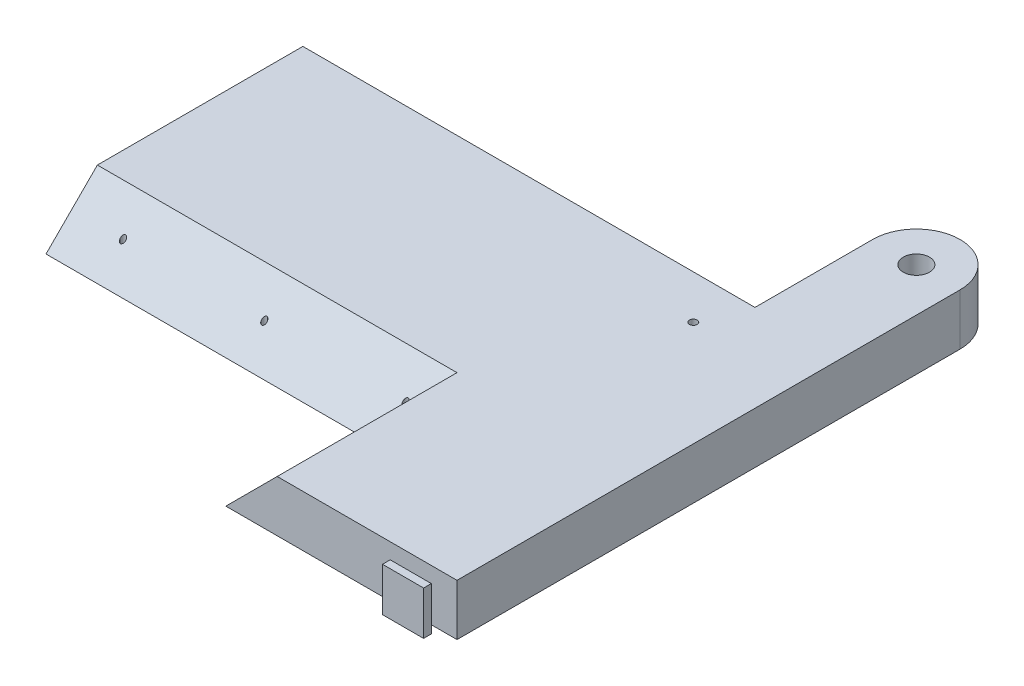
from build123d import *

# Parameters (mm, degrees)
CORNERBOSS_EXTRUDE1_DEPTH               = 20
SHELL1_T                                = -3
PUTBACKPARTOFSHELLBOSS_EXTRUDE1_DEPTH   = 17
TABHOLECUTSSKETCH1_R                    = 1
TABHOLECUTS_EXTRUDE3_DEPTH              = 267.480732183
PADSKETCH2_R                            = 12
PADSKETCH2_R_2                          = 5
PADBOSS_EXTRUDE2_DEPTH                  = 10
STEPPERRODHOLESKETCH3_R                 = 5.1
STEPPERRODHOLESKETCH3_R_2               = 1.5
STEPPERRODHOLECUT_EXTRUDE1_DEPTH        = 267.046951918
THREADEDNUTMOUNTHOLESSKETCH4_R          = 1
THREADEDNUTMOUNTHOLESCUT_EXTRUDE2_DEPTH = 10
TLPEGHOLESKETCH1_W                      = 10
TLPEGHOLESKETCH1_H                      = 14
TLPEGHOLECUT_EXTRUDE1_DEPTH             = 3
BOTTOMPEGSKETCH2_W                      = 9.8
BOTTOMPEGSKETCH2_H                      = 13.9
BOTTOMPEGBOSS_EXTRUDE1_DEPTH            = 3.1
BOTTOMPEGCAPSKETCH3_W                   = 16
BOTTOMPEGCAPSKETCH3_H                   = 17
BOTTOMPEGCAPBOSS_EXTRUDE2_DEPTH         = 3


with BuildPart() as part:
    # CornerSketch1 → CornerBoss-Extrude1 (new body)
    with BuildSketch(Plane(origin=(0, 0, 0), x_dir=(1, 0, 0), z_dir=(0, 1, 0))):
        with BuildLine():
            Line((210, -50), (120, -50))
            Line((120, -50), (120, 0))
            Line((120, 0), (0, 0))
            Line((0, 0), (0, 100))
            Line((0, 100), (176, 100))
            Line((176, 100), (176, 145.825))
            ThreePointArc((176, 145.825), (193, 162.825), (210, 145.825))
            Line((210, 145.825), (210, -50))
        make_face()
    extrude(amount=CORNERBOSS_EXTRUDE1_DEPTH)

    # Shell1
    shell1_openings = [part.faces().sort_by_distance(p)[0] for p in [
        (121.249517572, 0, -43.561989295),
    ]]
    offset(amount=SHELL1_T, openings=shell1_openings, kind=Kind.INTERSECTION)

    # PutBackPartOfShellSketch1 → PutBackPartOfShellBoss-Extrude1 (add)
    with BuildSketch(Plane.XZ.offset(-17)):
        Polygon((3, -3), (123, -3), (123, 47), (143, 47), (143, -23), (3, -23), align=None)
    extrude(amount=PUTBACKPARTOFSHELLBOSS_EXTRUDE1_DEPTH)

    # TabHoleCutsSketch1 → TabHoleCuts-Extrude3 (cut, through all)
    with BuildSketch(Plane.XZ):
        with Locations(Location((130, 30, 0), (0, 0, 270))):
            Circle(TABHOLECUTSSKETCH1_R)
        with Locations(Location((130, -10, 0), (0, 0, 270))):
            Circle(TABHOLECUTSSKETCH1_R)
        with Locations(Location((75, -10, 0), (0, 0, 270))):
            Circle(TABHOLECUTSSKETCH1_R)
        with Locations(Location((20, -10, 0), (0, 0, 270))):
            Circle(TABHOLECUTSSKETCH1_R)
    extrude(amount=-TABHOLECUTS_EXTRUDE3_DEPTH, mode=Mode.SUBTRACT)

    # PadSketch2 → PadBoss-Extrude2 (add)
    with BuildSketch(Plane.XZ.offset(-17)):
        with Locations(Location((193, -145.825, 0), (0, 0, 90))):
            Circle(PADSKETCH2_R)
        with Locations(Location((169, -83, 0), (0, 0, 90))):
            Circle(PADSKETCH2_R_2)
    extrude(amount=PADBOSS_EXTRUDE2_DEPTH)

    # StepperRodHoleSketch3 → StepperRodHoleCut-Extrude1 (cut, through all)
    with BuildSketch(Plane.XZ.offset(-7)):
        with Locations(Location((193, -145.825, 0), (0, 0, 270))):
            Circle(STEPPERRODHOLESKETCH3_R)
        with Locations(Location((169, -83, 0), (0, 0, 270))):
            Circle(STEPPERRODHOLESKETCH3_R_2)
    extrude(amount=-STEPPERRODHOLECUT_EXTRUDE1_DEPTH, mode=Mode.SUBTRACT)

    # ThreadedNutMountHolesSketch4 → ThreadedNutMountHolesCut-Extrude2 (cut)
    with BuildSketch(Plane(origin=(0, 7, 0), x_dir=(-1, 0, 0), z_dir=(0, -1, 0))):
        with Locations(Location((-193, 153.825, 0), (0, 0, 90))):
            Circle(THREADEDNUTMOUNTHOLESSKETCH4_R)
        with Locations(Location((-185, 145.825, 0), (0, 0, 90))):
            Circle(THREADEDNUTMOUNTHOLESSKETCH4_R)
        with Locations(Location((-201, 145.825, 0), (0, 0, 90))):
            Circle(THREADEDNUTMOUNTHOLESSKETCH4_R)
        with Locations(Location((-193, 137.825, 0), (0, 0, 90))):
            Circle(THREADEDNUTMOUNTHOLESSKETCH4_R)
    extrude(amount=-THREADEDNUTMOUNTHOLESCUT_EXTRUDE2_DEPTH, mode=Mode.SUBTRACT)

    # TLPegHoleSketch1 → TLPegHoleCut-Extrude1 (cut)
    with BuildSketch(Plane.ZY):
        with Locations((-85, 7)):
            Rectangle(TLPEGHOLESKETCH1_W, TLPEGHOLESKETCH1_H)
    extrude(amount=-TLPEGHOLECUT_EXTRUDE1_DEPTH, mode=Mode.SUBTRACT)

    # BottomPegSketch2 → BottomPegBoss-Extrude1 (add)
    with BuildSketch(Plane.XY.offset(50)):
        with Locations((195, 6.95)):
            Rectangle(BOTTOMPEGSKETCH2_W, BOTTOMPEGSKETCH2_H)
    extrude(amount=BOTTOMPEGBOSS_EXTRUDE1_DEPTH)

    # BottomPegCapSketch3 → BottomPegCapBoss-Extrude2 (add)
    with BuildSketch(Plane.XY.offset(53.1)):
        with Locations((195.1, 8.5)):
            Rectangle(BOTTOMPEGCAPSKETCH3_W, BOTTOMPEGCAPSKETCH3_H)
    extrude(amount=BOTTOMPEGCAPBOSS_EXTRUDE2_DEPTH)

    # OverlapChamfer1
    # the kernel refuses this chamfer: 20 mm, written as the material it takes off along each edge
    with BuildSketch(Plane(origin=(120, 20, 50), x_dir=(-0.027495876610586317, -0.9996219169112968, 0), z_dir=(0, 0, -1))) as overlapchamfer1_piece_1:
        with BuildLine():
            Line((20.573463904, 0), (-1.130943098, -20.54235587))
            Line((-1.130943098, -20.54235587), (-1.530791864, -20.53135752))
            ThreePointArc((-1.530791864, -20.53135752), (-0.682584541, -10.267956593), (-0.399848767, 0.010998351))
            Line((-0.399848767, 0.010998351), (0.010998351, 0.399848767))
            ThreePointArc((0.010998351, 0.399848767), (10.289953294, 0.117112992), (20.584462254, 0.399848767))
            Line((20.584462254, 0.399848767), (20.573463904, 0))
        make_face()
    extrude(amount=50, mode=Mode.SUBTRACT)
    with BuildSketch(Plane(origin=(120, 20, 0), x_dir=(0, -0.9996219169112968, 0.027495876610586372), z_dir=(-1, 0, 0))) as overlapchamfer1_piece_2:
        with BuildLine():
            Line((20.573463904, 0), (-1.130943098, -20.54235587))
            Line((-1.130943098, -20.54235587), (-1.530791864, -20.53135752))
            ThreePointArc((-1.530791864, -20.53135752), (-0.682584541, -10.267956593), (-0.399848767, 0.010998351))
            Line((-0.399848767, 0.010998351), (0.010998351, 0.399848767))
            ThreePointArc((0.010998351, 0.399848767), (10.289953294, 0.117112992), (20.584462254, 0.399848767))
            Line((20.584462254, 0.399848767), (20.573463904, 0))
        make_face()
    extrude(amount=120, mode=Mode.SUBTRACT)
    with BuildSketch(Plane(origin=(120, 20, 50), x_dir=(-0.027495876610586317, -0.9996219169112968, 0), z_dir=(0, 0, -1))) as overlapchamfer1_piece_3a_section:
        with BuildLine():
            Line((20.573463904, 0), (-1.130943098, -20.54235587))
            Line((-1.130943098, -20.54235587), (-1.530791864, -20.53135752))
            ThreePointArc((-1.530791864, -20.53135752), (-0.682584541, -10.267956593), (-0.399848767, 0.010998351))
            Line((-0.399848767, 0.010998351), (0.010998351, 0.399848767))
            ThreePointArc((0.010998351, 0.399848767), (10.289953294, 0.117112992), (20.584462254, 0.399848767))
            Line((20.584462254, 0.399848767), (20.573463904, 0))
        make_face()
    overlapchamfer1_piece_3a = extrude(amount=101.433659759, mode=Mode.PRIVATE)
    overlapchamfer1_piece_3a = split(overlapchamfer1_piece_3a, bisect_by=Plane(origin=(126.595872536, 13.404127464, 0), z_dir=(0, 0, -1)), keep=Keep.TOP, mode=Mode.PRIVATE)
    with BuildSketch(Plane(origin=(171.433659759, 20, 0), x_dir=(0, -0.9996219169112968, 0.027495876610586372), z_dir=(-1, 0, 0))) as overlapchamfer1_piece_3b_section:
        with BuildLine():
            Line((20.573463904, 0), (-1.130943098, -20.54235587))
            Line((-1.130943098, -20.54235587), (-1.530791864, -20.53135752))
            ThreePointArc((-1.530791864, -20.53135752), (-0.682584541, -10.267956593), (-0.399848767, 0.010998351))
            Line((-0.399848767, 0.010998351), (0.010998351, 0.399848767))
            ThreePointArc((0.010998351, 0.399848767), (10.289953294, 0.117112992), (20.584462254, 0.399848767))
            Line((20.584462254, 0.399848767), (20.573463904, 0))
        make_face()
    overlapchamfer1_piece_3b = extrude(amount=171.433659759, mode=Mode.PRIVATE)
    overlapchamfer1_piece_3b = split(overlapchamfer1_piece_3b, bisect_by=Plane(origin=(120, 13.404127464, -6.595872536), z_dir=(1, 0, 0)), keep=Keep.TOP, mode=Mode.PRIVATE)
    overlapchamfer1_piece_3 = overlapchamfer1_piece_3a & overlapchamfer1_piece_3b
    add(overlapchamfer1_piece_3, mode=Mode.SUBTRACT)


solid = part.part
